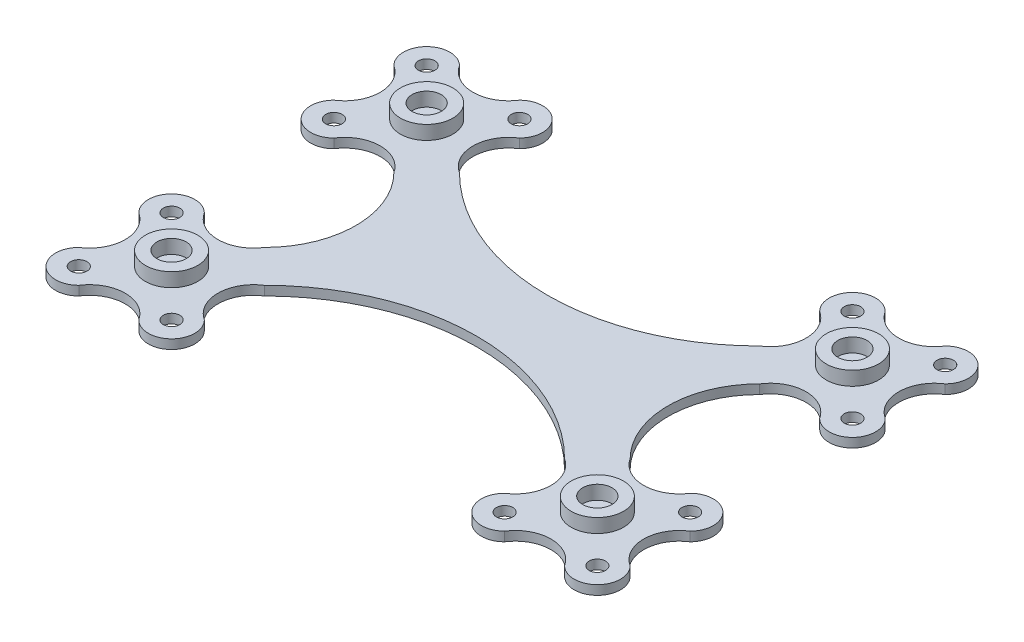
from build123d import *

# Parameters (mm, degrees)
BOSS_EXTRUDE1_DEPTH   = 2.54
SKETCH1_4_R           = 7.175
SKETCH1_4_R_2         = 4
BOSS_EXTRUDE2_DEPTH   = 6.35
F_8_CLEARANCE_HOLE2_D = 4.4958


with BuildPart() as part:
    # Sketch1 → Boss-Extrude1 (new body)
    with BuildSketch(Plane(origin=(0, 0, 0), x_dir=(1, 0, 0), z_dir=(0, 1, 0))):
        with BuildLine():
            ThreePointArc((-8.209871939, 17.190128061), (-17.190128061, 17.190128061), (-17.190128061, 8.209871939))
            ThreePointArc((-17.190128061, 8.209871939), (-12.7, 0), (-17.190128061, -8.209871939))
            ThreePointArc((-17.190128061, -8.209871939), (-17.190128061, -17.190128061), (-8.209871939, -17.190128061))
            ThreePointArc((-8.209871939, -17.190128061), (0, -12.7), (8.209871939, -17.190128061))
            ThreePointArc((8.209871939, -17.190128061), (15.555896424, -34.925), (8.209871939, -52.659871939))
            ThreePointArc((8.209871939, -52.659871939), (0, -57.15), (-8.209871939, -52.659871939))
            ThreePointArc((-8.209871939, -52.659871939), (-17.190128061, -52.659871939), (-17.190128061, -61.640128061))
            ThreePointArc((-17.190128061, -61.640128061), (-12.7, -69.85), (-17.190128061, -78.059871939))
            ThreePointArc((-17.190128061, -78.059871939), (-17.190128061, -87.040128061), (-8.209871939, -87.040128061))
            ThreePointArc((-8.209871939, -87.040128061), (0, -82.55), (8.209871939, -87.040128061))
            ThreePointArc((8.209871939, -87.040128061), (17.190128061, -87.040128061), (17.190128061, -78.059871939))
            ThreePointArc((17.190128061, -78.059871939), (12.7, -69.85), (17.190128061, -61.640128061))
            ThreePointArc((17.190128061, -61.640128061), (58.293, -44.614761051), (99.395871939, -61.640128061))
            ThreePointArc((99.395871939, -61.640128061), (103.886, -69.85), (99.395871939, -78.059871939))
            ThreePointArc((99.395871939, -78.059871939), (99.395871939, -87.040128061), (108.376128061, -87.040128061))
            ThreePointArc((108.376128061, -87.040128061), (116.586, -82.55), (124.795871939, -87.040128061))
            ThreePointArc((124.795871939, -87.040128061), (133.776128061, -87.040128061), (133.776128061, -78.059871939))
            ThreePointArc((133.776128061, -78.059871939), (129.286, -69.85), (133.776128061, -61.640128061))
            ThreePointArc((133.776128061, -61.640128061), (133.776128061, -52.659871939), (124.795871939, -52.659871939))
            ThreePointArc((124.795871939, -52.659871939), (116.586, -57.15), (108.376128061, -52.659871939))
            ThreePointArc((108.376128061, -52.659871939), (101.030103576, -34.925), (108.376128061, -17.190128061))
            ThreePointArc((108.376128061, -17.190128061), (116.586, -12.7), (124.795871939, -17.190128061))
            ThreePointArc((124.795871939, -17.190128061), (133.776128061, -17.190128061), (133.776128061, -8.209871939))
            ThreePointArc((133.776128061, -8.209871939), (129.286, 0), (133.776128061, 8.209871939))
            ThreePointArc((133.776128061, 8.209871939), (133.776128061, 17.190128061), (124.795871939, 17.190128061))
            ThreePointArc((124.795871939, 17.190128061), (116.586, 12.7), (108.376128061, 17.190128061))
            ThreePointArc((108.376128061, 17.190128061), (99.395871939, 17.190128061), (99.395871939, 8.209871939))
            ThreePointArc((99.395871939, 8.209871939), (103.886, 0), (99.395871939, -8.209871939))
            ThreePointArc((99.395871939, -8.209871939), (58.293, -25.235238949), (17.190128061, -8.209871939))
            ThreePointArc((17.190128061, -8.209871939), (12.7, 0), (17.190128061, 8.209871939))
            ThreePointArc((17.190128061, 8.209871939), (17.190128061, 17.190128061), (8.209871939, 17.190128061))
            ThreePointArc((8.209871939, 17.190128061), (0, 12.7), (-8.209871939, 17.190128061))
        make_face()
    extrude(amount=BOSS_EXTRUDE1_DEPTH)

    # Sketch1<4> → Boss-Extrude2 (add)
    # profile 1 of 4: a face of its own
    with BuildSketch(Plane(origin=(0, 0, 0), x_dir=(1, 0, 0), z_dir=(0, 1, 0))):
        Circle(SKETCH1_4_R)
        Circle(SKETCH1_4_R_2, mode=Mode.SUBTRACT)
    # profile 2 of 4: a face of its own
    with BuildSketch(Plane(origin=(0, 0, 0), x_dir=(1, 0, 0), z_dir=(0, 1, 0))):
        with Locations((116.586, 0)):
            Circle(SKETCH1_4_R)
        with Locations((116.586, 0)):
            Circle(SKETCH1_4_R_2, mode=Mode.SUBTRACT)
    # profile 3 of 4: a face of its own
    with BuildSketch(Plane(origin=(0, 0, 0), x_dir=(1, 0, 0), z_dir=(0, 1, 0))):
        with Locations((0, -69.85)):
            Circle(SKETCH1_4_R)
        with Locations((0, -69.85)):
            Circle(SKETCH1_4_R_2, mode=Mode.SUBTRACT)
    # profile 4 of 4: a face of its own
    with BuildSketch(Plane(origin=(0, 0, 0), x_dir=(1, 0, 0), z_dir=(0, 1, 0))):
        with Locations((116.586, -69.85)):
            Circle(SKETCH1_4_R)
        with Locations((116.586, -69.85)):
            Circle(SKETCH1_4_R_2, mode=Mode.SUBTRACT)
    extrude(amount=BOSS_EXTRUDE2_DEPTH)

    # #8 Clearance Hole2 (through all)
    with Locations(Plane(origin=(0, 2.54, 0), x_dir=(1, 0, 0), z_dir=(0, 1, 0))):
        with Locations((103.886, 12.7), (129.286, 12.7), (129.286, -12.7), (129.286, -57.15), (129.286, -82.55), (103.886, -82.55), (12.7, -82.55), (-12.7, -82.55), (-12.7, -57.15), (-12.7, -12.7), (-12.7, 12.7), (12.7, 12.7)):
            Hole(F_8_CLEARANCE_HOLE2_D / 2)


solid = part.part
